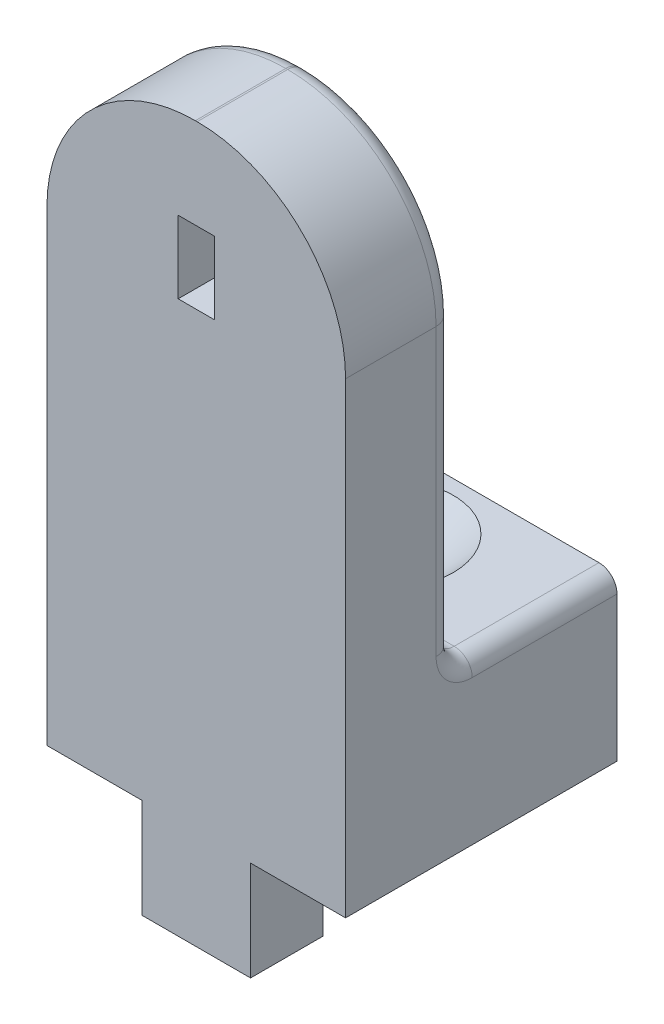
from build123d import *

# Parameters (mm, degrees)
SKETCH1_W               = 16.5
SKETCH1_H               = 15
SKETCH1_R               = 2.2
BOSS_EXTRUDE1_DEPTH     = 9
CHAMFER1_SIZE           = 1.5
SKETCH2_W               = 16.5
SKETCH2_H               = 6
BOSS_EXTRUDE2_DEPTH     = 25
CUT_EXTRUDE2_DEPTH      = 37.125648783
CUT_EXTRUDE2_DEPTH_BACK = 37.125648783
SKETCH4_W               = 1
SKETCH4_H               = 4
SKETCH4_3_W             = 4
SKETCH4_3_H             = 6
SKETCH4_3_W_2           = 2
SKETCH4_3_H_2           = 4
CUT_EXTRUDE3_DEPTH      = 1
FILLET1_R               = 1
SKETCH7_W               = 4
SKETCH7_H               = 1
BOSS_EXTRUDE4_DEPTH     = 1
FILLET2_R               = 8.2
SKETCH8_W               = 6
SKETCH8_H               = 4
BOSS_EXTRUDE5_DEPTH     = 5.5


with BuildPart() as part:
    # Sketch1 → Boss-Extrude1 (new body)
    with BuildSketch(Plane(origin=(0, 0, 0), x_dir=(1, 0, 0), z_dir=(0, 1, 0))):
        Rectangle(SKETCH1_W, SKETCH1_H)
        with Locations(Location((0, 3, 0), (0, 0, 270))):
            Circle(SKETCH1_R, mode=Mode.SUBTRACT)
    extrude(amount=BOSS_EXTRUDE1_DEPTH)

    # Chamfer1
    chamfer1_edges = [part.edges().sort_by_distance(p)[0] for p in [
        (0, 9, -5.2),
    ]]
    chamfer(chamfer1_edges, length=CHAMFER1_SIZE)

    # Sketch2 → Boss-Extrude2 (add)
    with BuildSketch(Plane(origin=(0, 9, 0), x_dir=(1, 0, 0), z_dir=(0, 1, 0))):
        with Locations((0, -4.5)):
            Rectangle(SKETCH2_W, SKETCH2_H)
    extrude(amount=BOSS_EXTRUDE2_DEPTH)

    # Sketch4 → Cut-Extrude2 (cut, two sides: drawn at the far end of the back side and taken through both)
    with BuildSketch(Plane(origin=(0, 0, 1.5), x_dir=(-1, 0, 0), z_dir=(0, 0, -1)).offset(-CUT_EXTRUDE2_DEPTH_BACK)):
        with Locations((0.5, 27)):
            Rectangle(SKETCH4_W, SKETCH4_H)
        with Locations((-0.5, 27)):
            Rectangle(SKETCH4_W, SKETCH4_H)
    extrude(amount=CUT_EXTRUDE2_DEPTH + CUT_EXTRUDE2_DEPTH_BACK, mode=Mode.SUBTRACT)

    # Sketch4<3> → Cut-Extrude3 (cut)
    with BuildSketch(Plane(origin=(0, 0, 1.5), x_dir=(-1, 0, 0), z_dir=(0, 0, -1))):
        with Locations((0, 27)):
            Rectangle(SKETCH4_3_W, SKETCH4_3_H)
        with Locations((0, 27)):
            Rectangle(SKETCH4_3_W_2, SKETCH4_3_H_2, mode=Mode.SUBTRACT)
    extrude(amount=-CUT_EXTRUDE3_DEPTH, mode=Mode.SUBTRACT)

    # Fillet1
    fillet1_edges = [part.edges().sort_by_distance(p)[0] for p in [
        (-8.25, 9, -3),
        (8.25, 9, -3),
        (-8.25, 21.5, 1.5),
        (0, 9, 1.5),
        (8.25, 21.5, 1.5),
        (0, 34, 1.5),
    ]]
    fillet(fillet1_edges, radius=FILLET1_R)

    # Sketch7 → Boss-Extrude4 (add)
    with BuildSketch(Plane(origin=(0, 0, 2.5), x_dir=(-1, 0, 0), z_dir=(0, 0, -1))):
        with Locations((0, 24.5)):
            Rectangle(SKETCH7_W, SKETCH7_H)
    extrude(amount=BOSS_EXTRUDE4_DEPTH)

    # Fillet2
    # the kernel refuses this fillet: 8.2 mm, written as the material it takes off along each edge
    with BuildSketch(Plane(origin=(-0.05, 25.8, 1.5), x_dir=(-1, 0, 0), z_dir=(0, -1, 0))) as fillet2_piece_1:
        with BuildLine():
            CenterArc((7.2, -1), 1, 0, 90)
            Line((8.2, -1), (8.2, 0))
            Line((8.2, 0), (7.2, 0))
        make_face()
    revolve(axis=Axis((-0.05, 25.8, 1.5), (0, 0, -1)), revolution_arc=90, mode=Mode.SUBTRACT)
    with BuildSketch(Plane(origin=(0.05, 25.8, 1.5), x_dir=(0, 1, 0), z_dir=(-1, 0, 0))) as fillet2_piece_2:
        with BuildLine():
            CenterArc((7.2, -1), 1, 0, 90)
            Line((8.2, -1), (8.2, 0))
            Line((8.2, 0), (7.2, 0))
        make_face()
    revolve(axis=Axis((0.05, 25.8, 1.5), (0, 0, -1)), revolution_arc=90, mode=Mode.SUBTRACT)
    with BuildSketch(Plane(origin=(8.25, 34, 1.5), x_dir=(0, -1, 0), z_dir=(0, 0, 1)), Plane(origin=(-8.25, 34, 28), x_dir=(0, -1, 0), z_dir=(0, 0, -1))) as fillet2_piece_3:
        with BuildLine():
            CenterArc((FILLET2_R, -FILLET2_R), FILLET2_R, 90, 90)
            Line((0, -FILLET2_R), (0, 0))
            Line((0, 0), (FILLET2_R, 0))
        make_face()
    extrude(amount=26.5, mode=Mode.SUBTRACT)

    # Sketch8 → Boss-Extrude5 (add)
    with BuildSketch(Plane.XZ):
        with Locations((0, 5.5)):
            Rectangle(SKETCH8_W, SKETCH8_H)
    extrude(amount=BOSS_EXTRUDE5_DEPTH)


solid = part.part
